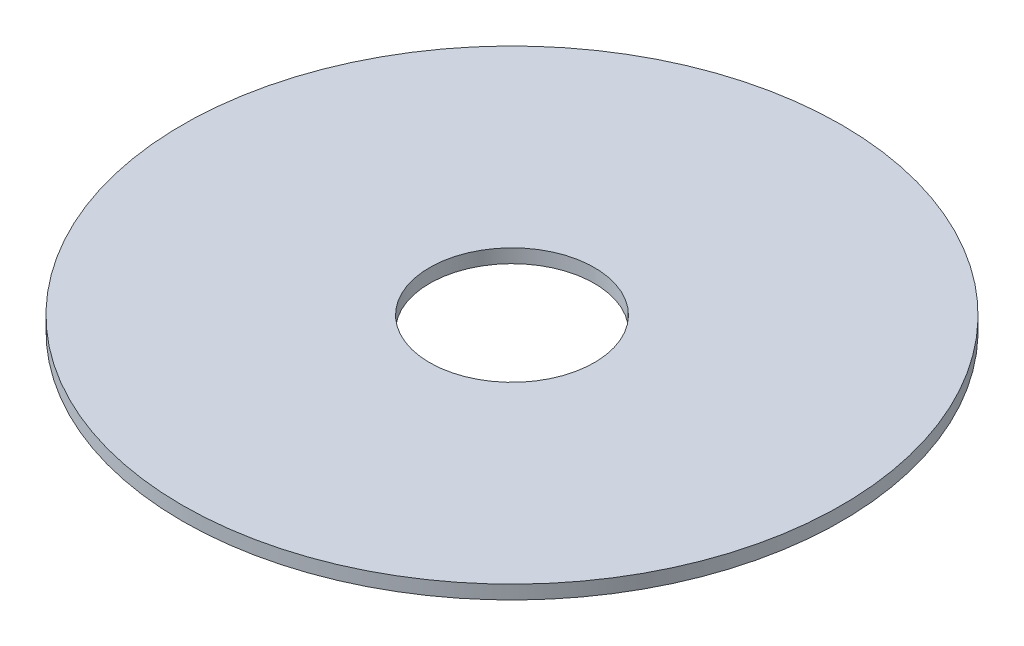
from build123d import *

# Parameters (mm, degrees)
SKETCH1_R           = 24
SKETCH1_R_2         = 6
BOSS_EXTRUDE1_DEPTH = 1


with BuildPart() as part:
    # Sketch1 → Boss-Extrude1 (new body)
    with BuildSketch(Plane(origin=(0, 0, 0), x_dir=(1, 0, 0), z_dir=(0, 1, 0))):
        Circle(SKETCH1_R)
        Circle(SKETCH1_R_2, mode=Mode.SUBTRACT)
    extrude(amount=BOSS_EXTRUDE1_DEPTH)


solid = part.part
